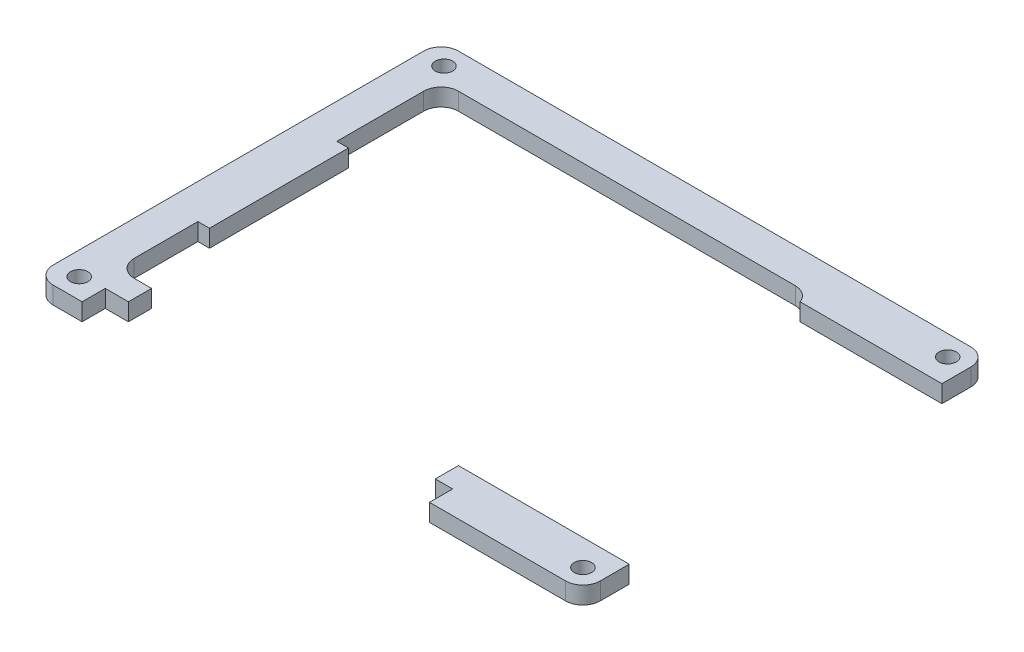
from build123d import *

# Parameters (mm, degrees)
SKETCH1_W           = 94.5
SKETCH1_H           = 70
BOSS_EXTRUDE1_DEPTH = 3
SKETCH3_R           = 1.5
CUT_EXTRUDE2_DEPTH  = 59.877521177
FILLET2_R           = 3
SKETCH5_W           = 24.5
SKETCH5_H           = 54
CUT_EXTRUDE3_DEPTH  = 59.877521177
FILLET3_R           = 3


with BuildPart() as part:
    # Sketch1 → Boss-Extrude1 (new body)
    with BuildSketch(Plane(origin=(0, 0, 0), x_dir=(1, 0, 0), z_dir=(0, 1, 0))):
        Rectangle(SKETCH1_W, SKETCH1_H)
    extrude(amount=BOSS_EXTRUDE1_DEPTH)

    # Sketch3 → Cut-Extrude2 (cut, through all)
    with BuildSketch(Plane(origin=(0, 3, 0), x_dir=(1, 0, 0), z_dir=(0, 1, 0))):
        with Locations(Location((43.75, 31.5, 0), (0, 0, 270))):
            Circle(SKETCH3_R)
        with Locations(Location((-43.25, 31.5, 0), (0, 0, 270))):
            Circle(SKETCH3_R)
        with Locations(Location((-43.25, -31.5, 0), (0, 0, 270))):
            Circle(SKETCH3_R)
        with Locations(Location((43.75, -31.5, 0), (0, 0, 270))):
            Circle(SKETCH3_R)
    extrude(amount=-CUT_EXTRUDE2_DEPTH, mode=Mode.SUBTRACT)

    # Fillet2
    fillet2_edges = [part.edges().sort_by_distance(p)[0] for p in [
        (47.25, 1.5, 35),
        (-47.25, 1.5, 35),
        (-47.25, 1.5, -35),
        (47.25, 1.5, -35),
    ]]
    fillet(fillet2_edges, radius=FILLET2_R)

    # Sketch5 → Cut-Extrude3 (cut, through all)
    with BuildSketch(Plane(origin=(0, 3, 0), x_dir=(1, 0, 0), z_dir=(0, 1, 0))):
        Polygon((22.75, 29), (-41.25, 29), (-41.25, 11), (-39.25, 11), (-39.25, -13), (-41.25, -13), (-41.25, -27), (-35.25, -27), (17.75, -27), (22.75, -27), (22.75, 27), align=None)
        Polygon((17.75, -31), (17.75, -27), (-35.25, -27), (-35.25, -31), (-39.25, -31), (-39.25, -35), (20.75, -35), (20.75, -31), align=None)
        with Locations((35, 0)):
            Rectangle(SKETCH5_W, SKETCH5_H)
    extrude(amount=-CUT_EXTRUDE3_DEPTH, mode=Mode.SUBTRACT)


with BuildPart() as cut_extrude3_piece_1:
    # of the separate pieces the step leaves, piece 1, a body of its own (cut_extrude3_pieces)
    add(part.part.solids().sort_by_distance((-44.25, 0, -35))[0])

    # Fillet3
    # the kernel refuses this fillet: 3 mm, written as the material it adds along each edge
    with BuildSketch(Plane(origin=(22.75, 3, -29), x_dir=(-1, 0, 0), z_dir=(0, -1, 0))) as fillet3_piece_1:
        with BuildLine():
            CenterArc((2.828427125, -3), FILLET3_R, 90, 70.528779366)
            Line((0, -2), (-0.056568542, -1.98))
            ThreePointArc((-0.056568542, -1.98), (-0.06, -1), (-0.06, 0))
            Line((-0.06, 0), (0, 0.06))
            Line((0, 0.06), (2.828427125, 0.06))
            Line((2.828427125, 0.06), (2.828427125, 0))
        make_face()
    extrude(amount=3)
    with BuildSketch(Plane(origin=(-41.25, 3, 27), x_dir=(1, 0, 0), z_dir=(0, -1, 0)), Plane(origin=(-41.25, 3, -29), x_dir=(0, 0, 1), z_dir=(0, -1, 0))) as fillet3_piece_2:
        with BuildLine():
            CenterArc((FILLET3_R, -FILLET3_R), FILLET3_R, 90, 90)
            Line((0, -FILLET3_R), (-FILLET3_R * 0.02, -FILLET3_R))
            Line((-FILLET3_R * 0.02, -FILLET3_R), (-FILLET3_R * 0.02, FILLET3_R * 0.02))
            Line((-FILLET3_R * 0.02, FILLET3_R * 0.02), (FILLET3_R, FILLET3_R * 0.02))
            Line((FILLET3_R, FILLET3_R * 0.02), (FILLET3_R, 0))
        make_face()
    extrude(amount=3)


with BuildPart() as cut_extrude3_piece_2:
    # of the separate pieces the step leaves, piece 2, a body of its own (cut_extrude3_pieces)
    add(part.part.solids().sort_by_distance((47.25, 0, 27))[0])


solid = Compound([cut_extrude3_piece_1.part, cut_extrude3_piece_2.part])
